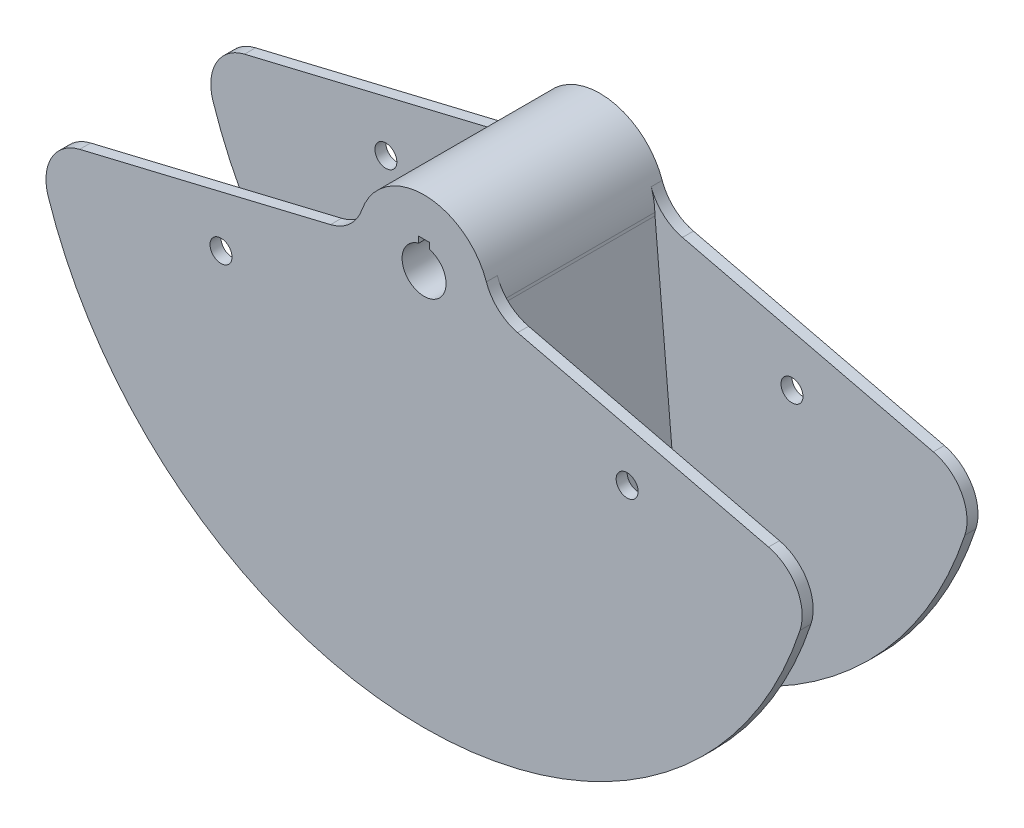
from build123d import *

# Parameters (mm, degrees)
SKETCH1_R               = 12.7
BOSS_EXTRUDE1_DEPTH     = 44.45
BOSS_EXTRUDE2_START     = 6.35
SKETCH5_R               = 12.7
SKETCH5_R_2             = 6.35
BOSS_EXTRUDE2_DEPTH     = 6.35
CUT_EXTRUDE1_DEPTH      = 321.268436395
CUT_EXTRUDE1_DEPTH_BACK = 321.268436395
SKETCH8_W               = 6.35
SKETCH8_H               = 6.35


with BuildPart() as part:
    # Sketch1 → Boss-Extrude1 (new, symmetric)
    with BuildSketch(Plane.XY):
        with BuildLine():
            Line((-57.457853875, -221.261282262), (-38.184359795, -0.964236874))
            ThreePointArc((-38.184359795, -0.964236874), (-38.124009824, -0.108037848), (-38.092623076, 0.749711395))
            ThreePointArc((-38.092623076, 0.749711395), (0, 38.1), (38.092623076, 0.749711395))
            ThreePointArc((38.092623076, 0.749711395), (38.124009824, -0.108037848), (38.184359795, -0.964236874))
            Line((38.184359795, -0.964236874), (57.457853875, -221.261282262))
            ThreePointArc((57.457853875, -221.261282262), (0, -228.6), (-57.457853875, -221.261282262))
        make_face()
        Circle(SKETCH1_R, mode=Mode.SUBTRACT)
    extrude(amount=BOSS_EXTRUDE1_DEPTH, both=True)

    # Sketch5 → Boss-Extrude2 (add)
    with BuildSketch(Plane.XY.offset(44.45).offset(BOSS_EXTRUDE2_START)):
        with BuildLine():
            Line((-199.008965168, -38.630824682), (-54.04268144, -3.827499177))
            ThreePointArc((-54.04268144, -3.827499177), (-42.924981025, 2.041131203), (-35.983316209, 12.522418081))
            ThreePointArc((-35.983316209, 12.522418081), (0, 38.1), (35.983316209, 12.522418081))
            ThreePointArc((35.983316209, 12.522418081), (42.924981025, 2.041131203), (54.04268144, -3.827499177))
            Line((54.04268144, -3.827499177), (199.008965168, -38.630824682))
            ThreePointArc((199.008965168, -38.630824682), (215.258073745, -50.948843822), (217.214384542, -71.245148243))
            ThreePointArc((217.214384542, -71.245148243), (0, -228.6), (-217.214384542, -71.245148243))
            ThreePointArc((-217.214384542, -71.245148243), (-215.258073745, -50.948843822), (-199.008965168, -38.630824682))
        make_face()
        Circle(SKETCH5_R, mode=Mode.SUBTRACT)
        with Locations((-117.332700629, -48.60079591)):
            Circle(SKETCH5_R_2, mode=Mode.SUBTRACT)
        with Locations((117.332700629, -48.60079591)):
            Circle(SKETCH5_R_2, mode=Mode.SUBTRACT)
    boss_extrude2 = extrude(amount=-BOSS_EXTRUDE2_DEPTH)

    # Mirror1: Boss-Extrude2 across plane
    add(boss_extrude2.mirror(Plane.XY))

    # Sketch8 → Cut-Extrude1 (cut, two sides: drawn at the far end of the back side and taken through both)
    with BuildSketch(Plane.XY.offset(-CUT_EXTRUDE1_DEPTH_BACK)):
        with Locations((0, 12.7)):
            Rectangle(SKETCH8_W, SKETCH8_H)
    extrude(amount=CUT_EXTRUDE1_DEPTH + CUT_EXTRUDE1_DEPTH_BACK, mode=Mode.SUBTRACT)


solid = part.part
